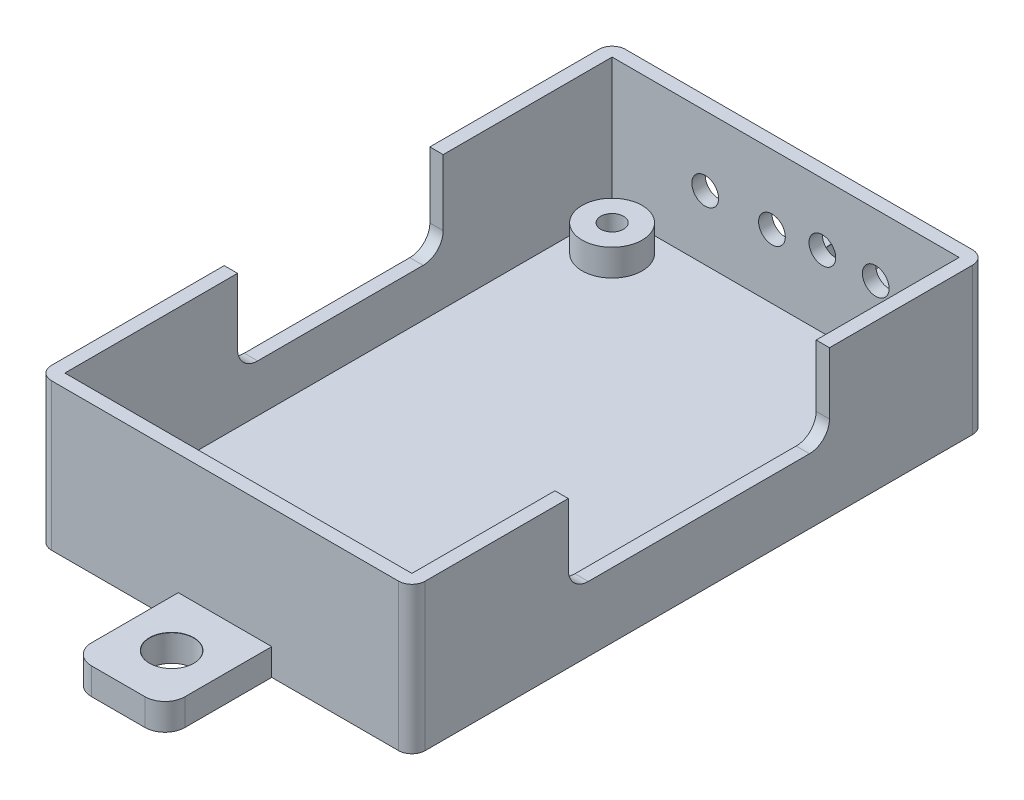
from build123d import *

# Parameters (mm, degrees)
SKIZZE1_W                                    = 56
SKIZZE1_H                                    = 86
AUFSATZ_LINEAR_AUSTRAGEN1_DEPTH              = 22
WANDUNG1_T                                   = -2
SKIZZE2_R                                    = 4.5
AUFSATZ_LINEAR_AUSTRAGEN2_DEPTH              = 4
VERRUNDUNG1_R                                = 2
STIRNSENKUNG_F_R_M3_ZYLINDERSCHRAUBE_2_COUNT = 2
STIRNSENKUNG_F_R_M3_ZYLINDERSCHRAUBE_2_PITCH = 81.987803971
STIRNSENKUNG_F_R_M3_ZYLINDERSCHRAUBE_3_COUNT = 2
STIRNSENKUNG_F_R_M3_ZYLINDERSCHRAUBE_3_PITCH = 71
STIRNSENKUNG_F_R_M3_ZYLINDERSCHRAUBE_4_COUNT = 2
STIRNSENKUNG_F_R_M3_ZYLINDERSCHRAUBE_4_PITCH = 41
SKIZZE8_W                                    = 39.14
SKIZZE8_H                                    = 12.26
SCHNITT_LINEAR_AUSTRAGEN3_DEPTH              = 10
VERRUNDUNG2_R                                = 3
SKIZZE9_W                                    = 30.81
SKIZZE9_H                                    = 12.87
SCHNITT_LINEAR_AUSTRAGEN4_DEPTH              = 10
VERRUNDUNG3_R                                = 3
SKIZZE10_R                                   = 2
SCHNITT_LINEAR_AUSTRAGEN5_DEPTH              = 10
SKIZZE11_W                                   = 14
SKIZZE11_H                                   = 16
AUFSATZ_LINEAR_AUSTRAGEN3_DEPTH              = 4
VERRUNDUNG4_R                                = 3
SPIEGELN1_OUTLINE_R                          = 3.3
SPIEGELN1_DEPTH                              = 4


with BuildPart() as part:
    # Skizze1 → Aufsatz-Linear austragen1 (new body)
    with BuildSketch(Plane(origin=(0, 0, 0), x_dir=(1, 0, 0), z_dir=(0, 1, 0))):
        with Locations((28, 43)):
            Rectangle(SKIZZE1_W, SKIZZE1_H)
    extrude(amount=AUFSATZ_LINEAR_AUSTRAGEN1_DEPTH)

    # Wandung1
    wandung1_openings = [part.faces().sort_by_distance(p)[0] for p in [
        (28, 22, -43),
    ]]
    offset(amount=WANDUNG1_T, openings=wandung1_openings, kind=Kind.INTERSECTION)

    # Skizze2 → Aufsatz-Linear austragen2 (add)
    with BuildSketch(Plane(origin=(0, 2, 0), x_dir=(1, 0, 0), z_dir=(0, 1, 0))):
        with Locations(Location((7.5, 7.5, 0), (0, 0, 90))):
            Circle(SKIZZE2_R)
        with Locations(Location((48.5, 7.5, 0), (0, 0, 90))):
            Circle(SKIZZE2_R)
        with Locations(Location((48.5, 78.5, 0), (0, 0, 90))):
            Circle(SKIZZE2_R)
        with Locations(Location((7.5, 78.5, 0), (0, 0, 90))):
            Circle(SKIZZE2_R)
    extrude(amount=AUFSATZ_LINEAR_AUSTRAGEN2_DEPTH)

    # Verrundung1
    verrundung1_edges = [part.edges().sort_by_distance(p)[0] for p in [
        (0, 11, -86),
        (56, 11, -86),
        (56, 11, 0),
        (0, 11, 0),
    ]]
    fillet(verrundung1_edges, radius=VERRUNDUNG1_R)

    # Skizze6 → Stirnsenkung für M3 Zylinderschraube mit Innensechskant1 (revolve, cut)
    with BuildSketch(Plane(origin=(48.5, 0, -7.5), x_dir=(0, 0, -1), z_dir=(1, 0, 0))):
        Polygon((0, 0), (0, 15.021463052), (1.7, 14), (1.7, 3.4), (3.25, 3.4), (3.25, 0.025), (3.275, 0), align=None)
    stirnsenkung_f_r_m3_zylinderschraube_mit = revolve(axis=Axis((48.5, -6.35, -7.5), (0, 1, 0)), mode=Mode.SUBTRACT)

    # Stirnsenkung f_r M3 Zylinderschraube 2: Stirnsenkung für M3 Zylinderschraube mit Innensechskant1 ×2
    with Locations(*[Vector(-0.5000743770922673, 0, -0.865982457891487) * (i * STIRNSENKUNG_F_R_M3_ZYLINDERSCHRAUBE_2_PITCH) for i in range(1, STIRNSENKUNG_F_R_M3_ZYLINDERSCHRAUBE_2_COUNT)]):
        add(stirnsenkung_f_r_m3_zylinderschraube_mit, mode=Mode.SUBTRACT)

    # Stirnsenkung f_r M3 Zylinderschraube 3: Stirnsenkung für M3 Zylinderschraube mit Innensechskant1 ×2
    with Locations(*[(0, 0, -i * STIRNSENKUNG_F_R_M3_ZYLINDERSCHRAUBE_3_PITCH) for i in range(1, STIRNSENKUNG_F_R_M3_ZYLINDERSCHRAUBE_3_COUNT)]):
        add(stirnsenkung_f_r_m3_zylinderschraube_mit, mode=Mode.SUBTRACT)

    # Stirnsenkung f_r M3 Zylinderschraube 4: Stirnsenkung für M3 Zylinderschraube mit Innensechskant1 ×2
    with Locations(*[(-i * STIRNSENKUNG_F_R_M3_ZYLINDERSCHRAUBE_4_PITCH, 0, 0) for i in range(1, STIRNSENKUNG_F_R_M3_ZYLINDERSCHRAUBE_4_COUNT)]):
        add(stirnsenkung_f_r_m3_zylinderschraube_mit, mode=Mode.SUBTRACT)

    # Skizze8 → Schnitt-Linear austragen3 (cut)
    with BuildSketch(Plane(origin=(56, 0, 0), x_dir=(0, 0, -1), z_dir=(1, 0, 0))):
        with Locations((43, 15.87)):
            Rectangle(SKIZZE8_W, SKIZZE8_H)
    extrude(amount=-SCHNITT_LINEAR_AUSTRAGEN3_DEPTH, mode=Mode.SUBTRACT)

    # Verrundung2
    verrundung2_edges = [part.edges().sort_by_distance(p)[0] for p in [
        (55, 9.74, -23.43),
        (55, 9.74, -62.57),
    ]]
    fillet(verrundung2_edges, radius=VERRUNDUNG2_R)

    # Skizze9 → Schnitt-Linear austragen4 (cut)
    with BuildSketch(Plane(origin=(2, 0, 0), x_dir=(0, 0, -1), z_dir=(1, 0, 0))):
        with Locations((43.285, 15.565)):
            Rectangle(SKIZZE9_W, SKIZZE9_H)
    extrude(amount=-SCHNITT_LINEAR_AUSTRAGEN4_DEPTH, mode=Mode.SUBTRACT)

    # Verrundung3
    verrundung3_edges = [part.edges().sort_by_distance(p)[0] for p in [
        (1, 9.13, -27.88),
        (1, 9.13, -58.69),
    ]]
    fillet(verrundung3_edges, radius=VERRUNDUNG3_R)

    # Skizze10 → Schnitt-Linear austragen5 (cut)
    with BuildSketch(Plane(origin=(0, 0, -86), x_dir=(-1, 0, 0), z_dir=(0, 0, -1))):
        with Locations((-41.5, 12.7)):
            Circle(SKIZZE10_R)
        with Locations((-33.5, 12.7)):
            Circle(SKIZZE10_R)
        with Locations((-25.95, 11.62)):
            Circle(SKIZZE10_R)
        with Locations((-15.95, 11.62)):
            Circle(SKIZZE10_R)
    extrude(amount=-SCHNITT_LINEAR_AUSTRAGEN5_DEPTH, mode=Mode.SUBTRACT)

    # Skizze11 → Aufsatz-Linear austragen3 (add)
    with BuildSketch(Plane(origin=(0, 0, 0), x_dir=(1, 0, 0), z_dir=(0, 1, 0))):
        with Locations((28, 94)):
            Rectangle(SKIZZE11_W, SKIZZE11_H)
    extrude(amount=AUFSATZ_LINEAR_AUSTRAGEN3_DEPTH)

    # Verrundung4
    verrundung4_edges = [part.edges().sort_by_distance(p)[0] for p in [
        (35, 2, -86),
        (35, 2, -102),
        (21, 2, -102),
        (21, 2, -86),
    ]]
    fillet(verrundung4_edges, radius=VERRUNDUNG4_R)

    # Skizze13 → Durchgangsloch für M61 (revolve, cut)
    with BuildSketch(Plane(origin=(28, 4, -94), x_dir=(0, 0, 1), z_dir=(1, 0, 0))):
        Polygon((0, 0), (0, 15.982840043), (3.3, 14), (3.3, 0.025), (3.325, 0), align=None)
    revolve(axis=Axis((28, 10.35, -94), (0, -1, 0)), mode=Mode.SUBTRACT)

    # Spiegeln1: read off the stored shape, not the designer's step
    # Spiegeln1 outline → Spiegeln1 (add)
    with BuildSketch(Plane(origin=(0, 0, 0), x_dir=(1, 0, 0), z_dir=(0, 1, 0))):
        with BuildLine():
            ThreePointArc((32, -16), (34.121320344, -15.121320344), (35, -13))
            Line((35, -13), (35, 0))
            Line((35, 0), (21, 0))
            Line((21, 0), (21, -13))
            ThreePointArc((21, -13), (21.878679656, -15.121320344), (24, -16))
            Line((24, -16), (32, -16))
        make_face()
        with Locations((28, -8)):
            Circle(SPIEGELN1_OUTLINE_R, mode=Mode.SUBTRACT)
    extrude(amount=SPIEGELN1_DEPTH)

    # Spiegeln1 2 outline → Spiegeln1 2 (revolve, cut)
    with BuildSketch(Plane(origin=(28, 0, 8), x_dir=(1, 0, 0), z_dir=(0, 0, 1))):
        Polygon((3.3, 4), (3.3, 3.975), (3.325, 4), align=None)
    revolve(axis=Axis((28, 0, 8), (0, 1, 0)), mode=Mode.SUBTRACT)


solid = part.part
